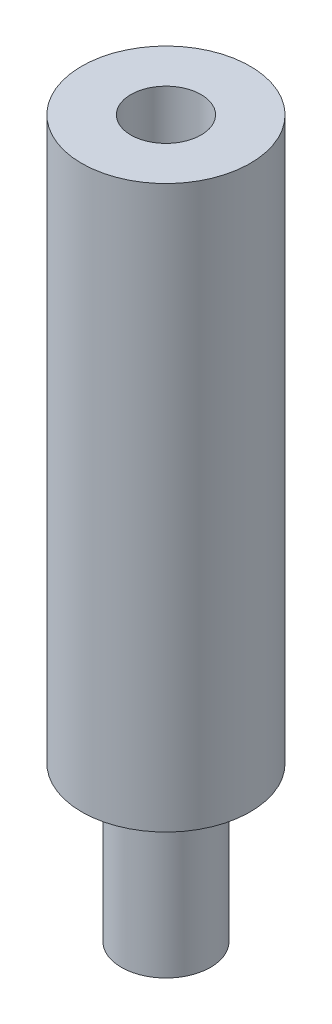
from build123d import *

# Parameters (mm, degrees)
SKETCH1_R           = 1.5875
SKETCH1_R_2         = 0.5
BOSS_EXTRUDE1_DEPTH = 5.5
SKETCH2_R           = 2
SKETCH2_R_2         = 1.5875
BOSS_EXTRUDE2_DEPTH = 0.25
SKETCH3_R           = 3
SKETCH3_R_2         = 0.5
BOSS_EXTRUDE3_DEPTH = 20
SKETCH4_R           = 1.25
CUT_EXTRUDE1_DEPTH  = 10


with BuildPart() as part:
    # Sketch1 → Boss-Extrude1 (new body)
    with BuildSketch(Plane(origin=(0, 0, 0), x_dir=(1, 0, 0), z_dir=(0, 1, 0))):
        Circle(SKETCH1_R)
        Circle(SKETCH1_R_2, mode=Mode.SUBTRACT)
    extrude(amount=BOSS_EXTRUDE1_DEPTH)

    # Sketch2 → Boss-Extrude2 (add)
    with BuildSketch(Plane(origin=(0, 5.25, 0), x_dir=(-1, 0, 0), z_dir=(0, -1, 0))):
        Circle(SKETCH2_R)
        Circle(SKETCH2_R_2, mode=Mode.SUBTRACT)
    extrude(amount=-BOSS_EXTRUDE2_DEPTH)

    # Sketch3 → Boss-Extrude3 (add)
    with BuildSketch(Plane(origin=(0, 5.5, 0), x_dir=(1, 0, 0), z_dir=(0, 1, 0))):
        Circle(SKETCH3_R)
        Circle(SKETCH3_R_2, mode=Mode.SUBTRACT)
    extrude(amount=BOSS_EXTRUDE3_DEPTH)

    # Sketch4 → Cut-Extrude1 (cut)
    with BuildSketch(Plane(origin=(0, 25.5, 0), x_dir=(1, 0, 0), z_dir=(0, 1, 0))):
        Circle(SKETCH4_R)
    extrude(amount=-CUT_EXTRUDE1_DEPTH, mode=Mode.SUBTRACT)


solid = part.part
